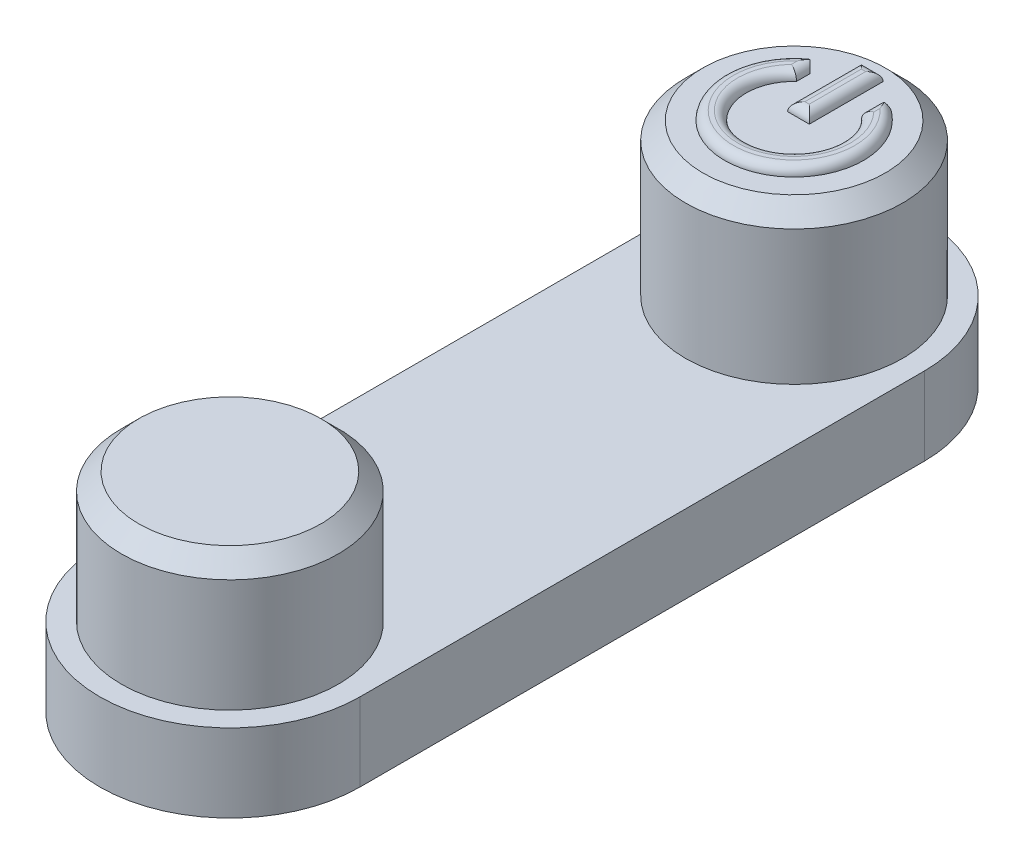
from build123d import *

# Parameters (mm, degrees)
BOSS_EXTRUDE1_DEPTH = 1.8
SKETCH2_R           = 2.500000000000001
BOSS_EXTRUDE2_DEPTH = 3
SKETCH3_R           = 2.5000000000000013
BOSS_EXTRUDE3_DEPTH = 0.5
CHAMFER1_SIZE       = 0.4
SKETCH4_W           = 0.5
SKETCH4_H           = 1.7000000000000002
BOSS_EXTRUDE4_DEPTH = 0.2
CHAMFER2_SIZE       = 0.3
CHAMFER2_SIZE_2     = 0.221880218
FILLET1_R           = 0.2


with BuildPart() as part:
    # Sketch1 → Boss-Extrude1 (new body)
    with BuildSketch(Plane(origin=(0, 0, 0), x_dir=(1, 0, 0), z_dir=(0, 1, 0))):
        with BuildLine():
            Line((-3, -6.5), (-3.0000000000000027, 6.499999999999998))
            ThreePointArc((-3.0000000000000027, 6.499999999999998), (-4.2e-15, 9.5), (2.9999999999999973, 6.500000000000002))
            Line((2.9999999999999973, 6.500000000000002), (3, -6.5))
            ThreePointArc((3, -6.5), (-5.5e-16, -9.5), (-3, -6.5))
        make_face()
    extrude(amount=BOSS_EXTRUDE1_DEPTH)

    # Sketch2 → Boss-Extrude2 (add)
    with BuildSketch(Plane(origin=(0, 1.8, 0), x_dir=(1, 0, 0), z_dir=(0, 1, 0))):
        with Locations(Location((-2.39e-15, 6.5, 0), (0, 0, 270))):
            Circle(SKETCH2_R)
        with Locations(Location((0, -6.5, 0), (0, 0, 270))):
            Circle(SKETCH2_R)
    extrude(amount=BOSS_EXTRUDE2_DEPTH)

    # Sketch3 → Boss-Extrude3 (add)
    with BuildSketch(Plane(origin=(0, 4.800000000000001, 0), x_dir=(1, 0, 0), z_dir=(0, 1, 0))):
        with Locations(Location((-2.39e-15, 6.5, 0), (0, 0, 270))):
            Circle(SKETCH3_R)
    extrude(amount=BOSS_EXTRUDE3_DEPTH)

    # Chamfer1
    chamfer1_edges = [part.edges().sort_by_distance(p)[0] for p in [
        (7.7e-16, 4.8, 3.999999999999999),
        (-1.62e-15, 5.300000000000001, -9.000000000000002),
    ]]
    chamfer(chamfer1_edges, length=CHAMFER1_SIZE)

    # Sketch4 → Boss-Extrude4 (add)
    with BuildSketch(Plane(origin=(0, 5.300000000000001, 0), x_dir=(1, 0, 0), z_dir=(0, 1, 0))):
        with BuildLine():
            Line((-0.75, 7.913329402510258), (-0.75, 7.304673846971556))
            ThreePointArc((-0.75, 7.304673846971556), (-4.54e-15, 5.4), (0.75, 7.304673846971556))
            Line((0.75, 7.304673846971556), (0.75, 7.913329402510258))
            ThreePointArc((0.75, 7.913329402510258), (-5.52e-15, 4.9), (-0.75, 7.913329402510258))
        make_face()
        with Locations((-2.76e-15, 7.449999999999999)):
            Rectangle(SKETCH4_W, SKETCH4_H)
    extrude(amount=BOSS_EXTRUDE4_DEPTH)

    # Chamfer2
    # the kernel refuses this chamfer: 0.3, 0.221880218 mm, written as the material it takes off along each edge
    with BuildSketch(Plane(origin=(-0.75, 5.300000000000001, -7.913329402510258), x_dir=(0, 0, 1), z_dir=(0, 1, 0))) as chamfer2_piece_1:
        with BuildLine():
            Line((CHAMFER2_SIZE, 0), (0.11497408326020686, -0.18502591673979885))
            ThreePointArc((0.11497408326020686, -0.18502591673979885), (0.05505412011014688, -0.09562891224277614), (0, 0))
            Line((0, 0), (CHAMFER2_SIZE, 0))
        make_face()
    extrude(amount=0.9715048963897726, mode=Mode.SUBTRACT)
    with BuildSketch(Plane(origin=(0.75, 5.300000000000001, -7.913329402510258), x_dir=(0.8394299671515956, 0, 0.5434678741635711), z_dir=(0, 1, 0))) as chamfer2_piece_2:
        with BuildLine():
            Line((0.27705330102285075, 2e-17), (CHAMFER2_SIZE_2 * 0.543467874804, -CHAMFER2_SIZE_2 * 0.83942996814))
            Line((CHAMFER2_SIZE_2 * 0.543467874804, -CHAMFER2_SIZE_2 * 0.83942996814), (0, 0))
            ThreePointArc((0, 0), (0.14238943823073183, 0.00600337759415658), (0.27705330102285075, 2e-17))
        make_face()
    extrude(amount=0.9123006442989672, mode=Mode.SUBTRACT)

    # Fillet1
    # the kernel refuses this fillet: 0.2 mm, written as the material it takes off along each edge
    with BuildSketch(Plane(origin=(-0.7500000000000032, 5.500000000000001, -6.599999999999999), x_dir=(0, -1, 0), z_dir=(1, 0, 0))) as fillet1_piece_1:
        with BuildLine():
            CenterArc((FILLET1_R, FILLET1_R), FILLET1_R, 180, 90)
            Line((0, FILLET1_R), (0, 0))
            Line((0, 0), (FILLET1_R, 0))
        make_face()
    extrude(amount=1.5000000000000009, mode=Mode.SUBTRACT)
    with BuildSketch(Plane(origin=(-0.2500000000000028, 5.500000000000001, -8.799999999999999), x_dir=(0, -1, 0), z_dir=(0, 0, 1)), Plane(origin=(0.24999999999999725, 5.500000000000001, -6.099999999999998), x_dir=(0, -1, 0), z_dir=(0, 0, -1))) as fillet1_piece_2:
        with BuildLine():
            CenterArc((FILLET1_R, FILLET1_R), FILLET1_R, 180, 90)
            Line((0, FILLET1_R), (0, 0))
            Line((0, 0), (FILLET1_R, 0))
        make_face()
    extrude(amount=2.700000000000001, mode=Mode.SUBTRACT)
    with BuildSketch(Plane(origin=(0.7499999999999977, 5.500000000000001, -8.299999999999999), x_dir=(0, -1, 0), z_dir=(-1, 0, 0))) as fillet1_piece_3:
        with BuildLine():
            CenterArc((FILLET1_R, FILLET1_R), FILLET1_R, 180, 90)
            Line((0, FILLET1_R), (0, 0))
            Line((0, 0), (FILLET1_R, 0))
        make_face()
    extrude(amount=1.5000000000000009, mode=Mode.SUBTRACT)
    with BuildSketch(Plane(origin=(-0.75, 5.500000000000001, -8.11332940251), x_dir=(0, -1, 0), z_dir=(0, 0, 1))) as fillet1_piece_4:
        with BuildLine():
            CenterArc((FILLET1_R, -FILLET1_R), FILLET1_R, 90, 90)
            Line((0, -FILLET1_R), (0, 0))
            Line((0, 0), (FILLET1_R, 0))
        make_face()
    extrude(amount=1.3086555555384454, mode=Mode.SUBTRACT)
    with BuildSketch(Plane(origin=(-8e-17, 5.500000000000001, -6.500000000000001), x_dir=(-0.2897858618854929, 0, -0.9570915077730457), z_dir=(0.9570915077730457, 0, -0.2897858618854929))) as fillet1_piece_5:
        with BuildLine():
            CenterArc((1.1000000000000005 + FILLET1_R, -FILLET1_R), FILLET1_R, 90.00000000000006, 89.99999999999994)
            Line((1.1000000000000005 + FILLET1_R, 0), (1.1000000000000005, 0))
            Line((1.1000000000000005, 0), (1.1000000000000005, -FILLET1_R))
        make_face()
    revolve(axis=Axis((-8e-17, 5.500000000000001, -6.500000000000001), (0, 1, 0)), revolution_arc=326.3097273547943, mode=Mode.SUBTRACT)
    with BuildSketch(Plane(origin=(0.75, 5.500000000000001, -6.804673846971555), x_dir=(0, -1, 0), z_dir=(0, 0, -1))) as fillet1_piece_6:
        with BuildLine():
            CenterArc((FILLET1_R, -FILLET1_R), FILLET1_R, 90, 90)
            Line((0, -FILLET1_R), (0, 0))
            Line((0, 0), (FILLET1_R, 0))
        make_face()
    extrude(amount=1.3867753372771254, mode=Mode.SUBTRACT)
    with BuildSketch(Plane(origin=(8e-17, 5.500000000000001, -6.500000000000001), x_dir=(0.3405261643731297, 0, -0.9402350404964305), z_dir=(-0.9402350404964305, 0, -0.3405261643731297))) as fillet1_piece_7:
        with BuildLine():
            CenterArc((1.5999999999999999 - FILLET1_R, FILLET1_R), FILLET1_R, 270, 90)
            Line((1.5999999999999999 - FILLET1_R, 0), (1.5999999999999999, 0))
            Line((1.5999999999999999, 0), (1.5999999999999999, FILLET1_R))
        make_face()
    revolve(axis=Axis((8e-17, 5.500000000000001, -6.500000000000001), (0, -1, 0)), revolution_arc=322.309003529889, mode=Mode.SUBTRACT)


solid = part.part
